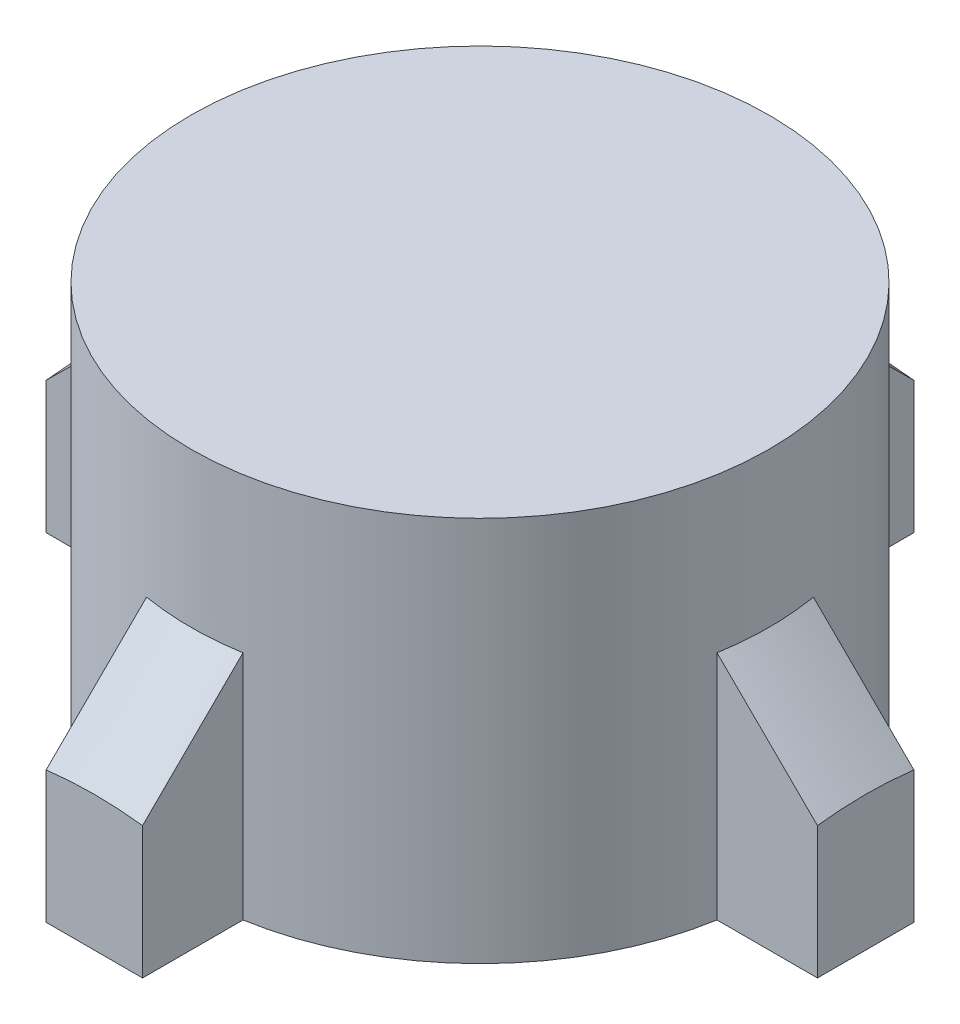
from build123d import *

# Parameters (mm, degrees)
SKETCH1_R           = 75
BOSS_EXTRUDE1_DEPTH = 100
BOSS_EXTRUDE2_DEPTH = 10
CHAMFER1_SIZE       = 50


with BuildPart() as part:
    # Sketch1 → Boss-Extrude1 (new body)
    with BuildSketch(Plane(origin=(0, 0, 0), x_dir=(1, 0, 0), z_dir=(0, 1, 0))):
        with Locations(Location((0, 0, 0), (0, 0, 270))):
            Circle(SKETCH1_R)
    extrude(amount=BOSS_EXTRUDE1_DEPTH)

    # Sketch2 → Boss-Extrude2 (add)
    with BuildSketch(Plane.XZ):
        with BuildLine():
            Line((-100, 12.5), (-100, -12.5))
            Line((-100, -12.5), (-73.950997289, -12.5))
            ThreePointArc((-73.950997289, -12.5), (-75, 0), (-73.950997289, 12.5))
            Line((-73.950997289, 12.5), (-100, 12.5))
        make_face()
        with BuildLine():
            ThreePointArc((75, 0), (74.737289209, -6.271969521), (73.950997289, -12.5))
            Line((73.950997289, -12.5), (100, -12.5))
            Line((100, -12.5), (100, 12.5))
            Line((100, 12.5), (73.950997289, 12.5))
            ThreePointArc((73.950997289, 12.5), (74.737289209, 6.271969521), (75, 0))
        make_face()
        with BuildLine():
            Line((-12.5, 100), (-12.5, 73.950997289))
            ThreePointArc((-12.5, 73.950997289), (0, 75), (12.5, 73.950997289))
            Line((12.5, 73.950997289), (12.5, 100))
            Line((12.5, 100), (-12.5, 100))
        make_face()
        with BuildLine():
            ThreePointArc((12.5, -73.950997289), (0, -75), (-12.5, -73.950997289))
            Line((-12.5, -73.950997289), (-12.5, -100))
            Line((-12.5, -100), (12.5, -100))
            Line((12.5, -100), (12.5, -73.950997289))
        make_face()
    extrude(amount=-BOSS_EXTRUDE2_DEPTH)

    # Chamfer1
    # the kernel refuses this chamfer: 50 mm, written as the material it adds along each edge
    with BuildSketch(Plane(origin=(0, 10, 0), x_dir=(0.9519856818942184, 0, 0.30614255089484044), z_dir=(-0.30614255089484044, 0, 0.9519856818942184))) as chamfer1_piece_1_section:
        Polygon((75, CHAMFER1_SIZE), (75 + CHAMFER1_SIZE, 0), (75, 0), align=None)
    chamfer1_piece_1 = revolve(axis=Axis((0, 10, 0), (0, 1, 0)), revolution_arc=215.653831418, mode=Mode.PRIVATE)
    chamfer1_piece_1 = split(chamfer1_piece_1, bisect_by=Plane(origin=(-12.5, 29.622120316, 1e-09), z_dir=(1, 0, 0)), keep=Keep.TOP, mode=Mode.PRIVATE)
    chamfer1_piece_1 = split(chamfer1_piece_1, bisect_by=Plane(origin=(85.193298793, 29.622120316, 12.5), z_dir=(0, 0, -1)), keep=Keep.TOP, mode=Mode.PRIVATE)
    chamfer1_piece_1 = split(chamfer1_piece_1, bisect_by=Plane(origin=(85.193298793, 29.622120316, -12.5), z_dir=(0, 0, 1)), keep=Keep.TOP, mode=Mode.PRIVATE)
    chamfer1_piece_1 = split(chamfer1_piece_1, bisect_by=Plane(origin=(100, 29.622120316, 1e-09), z_dir=(-1, 0, 0)), keep=Keep.TOP, mode=Mode.PRIVATE)
    add(chamfer1_piece_1)
    with BuildSketch(Plane(origin=(0, 10, 0), x_dir=(0.9519856818942184, 0, 0.30614255089484044), z_dir=(-0.30614255089484044, 0, 0.9519856818942184))) as chamfer1_piece_2_section:
        Polygon((75, CHAMFER1_SIZE), (75 + CHAMFER1_SIZE, 0), (75, 0), align=None)
    chamfer1_piece_2 = revolve(axis=Axis((0, 10, 0), (0, 1, 0)), revolution_arc=215.653831418, mode=Mode.PRIVATE)
    chamfer1_piece_2 = split(chamfer1_piece_2, bisect_by=Plane(origin=(12.5, 29.62212033, -85.19329881), z_dir=(-1, 0, 0)), keep=Keep.TOP, mode=Mode.PRIVATE)
    chamfer1_piece_2 = split(chamfer1_piece_2, bisect_by=Plane(origin=(-12.5, 29.62212033, -85.19329881), z_dir=(1, 0, 0)), keep=Keep.TOP, mode=Mode.PRIVATE)
    chamfer1_piece_2 = split(chamfer1_piece_2, bisect_by=Plane(origin=(0, 29.62212033, -100), z_dir=(0, 0, 1)), keep=Keep.TOP, mode=Mode.PRIVATE)
    add(chamfer1_piece_2)
    with BuildSketch(Plane(origin=(0, 10, 0), x_dir=(0.9519856818942184, 0, 0.30614255089484044), z_dir=(-0.30614255089484044, 0, 0.9519856818942184))) as chamfer1_piece_3_section:
        Polygon((75, CHAMFER1_SIZE), (75 + CHAMFER1_SIZE, 0), (75, 0), align=None)
    chamfer1_piece_3 = revolve(axis=Axis((0, 10, 0), (0, 1, 0)), revolution_arc=215.653831418, mode=Mode.PRIVATE)
    chamfer1_piece_3 = split(chamfer1_piece_3, bisect_by=Plane(origin=(-12.5, 29.622120318, 1e-09), z_dir=(-1, 0, 0)), keep=Keep.TOP, mode=Mode.PRIVATE)
    chamfer1_piece_3 = split(chamfer1_piece_3, bisect_by=Plane(origin=(-85.193298793, 29.622120318, 12.5), z_dir=(0, 0, -1)), keep=Keep.TOP, mode=Mode.PRIVATE)
    chamfer1_piece_3 = split(chamfer1_piece_3, bisect_by=Plane(origin=(-85.193298793, 29.622120318, -12.5), z_dir=(0, 0, 1)), keep=Keep.TOP, mode=Mode.PRIVATE)
    chamfer1_piece_3 = split(chamfer1_piece_3, bisect_by=Plane(origin=(-100, 29.622120318, 1e-09), z_dir=(1, 0, 0)), keep=Keep.TOP, mode=Mode.PRIVATE)
    add(chamfer1_piece_3)
    with BuildSketch(Plane(origin=(0, 10, 0), x_dir=(-0.30614255089485254, 0, 0.9519856818942145), z_dir=(-0.9519856818942145, 0, -0.30614255089485254))) as chamfer1_piece_4_section:
        Polygon((75, CHAMFER1_SIZE), (75 + CHAMFER1_SIZE, 0), (75, 0), align=None)
    chamfer1_piece_4 = revolve(axis=Axis((0, 10, 0), (0, 1, 0)), revolution_arc=215.653831418, mode=Mode.PRIVATE)
    chamfer1_piece_4 = split(chamfer1_piece_4, bisect_by=Plane(origin=(-1e-09, 29.622120316, -12.5), z_dir=(0, 0, 1)), keep=Keep.TOP, mode=Mode.PRIVATE)
    chamfer1_piece_4 = split(chamfer1_piece_4, bisect_by=Plane(origin=(12.5, 29.622120316, 85.193298793), z_dir=(-1, 0, 0)), keep=Keep.TOP, mode=Mode.PRIVATE)
    chamfer1_piece_4 = split(chamfer1_piece_4, bisect_by=Plane(origin=(-1e-09, 29.622120316, 100), z_dir=(0, 0, -1)), keep=Keep.TOP, mode=Mode.PRIVATE)
    chamfer1_piece_4 = split(chamfer1_piece_4, bisect_by=Plane(origin=(-12.5, 29.622120316, 85.193298793), z_dir=(1, 0, 0)), keep=Keep.TOP, mode=Mode.PRIVATE)
    add(chamfer1_piece_4)
    with BuildSketch(Plane(origin=(0, 10, 0), x_dir=(-0.30614255089485254, 0, 0.9519856818942145), z_dir=(-0.9519856818942145, 0, -0.30614255089485254))) as chamfer1_piece_5_section:
        Polygon((75, CHAMFER1_SIZE), (75 + CHAMFER1_SIZE, 0), (75, 0), align=None)
    chamfer1_piece_5 = revolve(axis=Axis((0, 10, 0), (0, 1, 0)), revolution_arc=215.653831418, mode=Mode.PRIVATE)
    chamfer1_piece_5 = split(chamfer1_piece_5, bisect_by=Plane(origin=(85.19329881, 29.62212033, 12.5), z_dir=(0, 0, -1)), keep=Keep.TOP, mode=Mode.PRIVATE)
    chamfer1_piece_5 = split(chamfer1_piece_5, bisect_by=Plane(origin=(85.19329881, 29.62212033, -12.5), z_dir=(0, 0, 1)), keep=Keep.TOP, mode=Mode.PRIVATE)
    chamfer1_piece_5 = split(chamfer1_piece_5, bisect_by=Plane(origin=(100, 29.62212033, 0), z_dir=(-1, 0, 0)), keep=Keep.TOP, mode=Mode.PRIVATE)
    add(chamfer1_piece_5)
    with BuildSketch(Plane(origin=(0, 10, 0), x_dir=(-0.30614255089485254, 0, 0.9519856818942145), z_dir=(-0.9519856818942145, 0, -0.30614255089485254))) as chamfer1_piece_6_section:
        Polygon((75, CHAMFER1_SIZE), (75 + CHAMFER1_SIZE, 0), (75, 0), align=None)
    chamfer1_piece_6 = revolve(axis=Axis((0, 10, 0), (0, 1, 0)), revolution_arc=215.653831418, mode=Mode.PRIVATE)
    chamfer1_piece_6 = split(chamfer1_piece_6, bisect_by=Plane(origin=(-1e-09, 29.622120318, -12.5), z_dir=(0, 0, -1)), keep=Keep.TOP, mode=Mode.PRIVATE)
    chamfer1_piece_6 = split(chamfer1_piece_6, bisect_by=Plane(origin=(12.5, 29.622120318, -85.193298793), z_dir=(-1, 0, 0)), keep=Keep.TOP, mode=Mode.PRIVATE)
    chamfer1_piece_6 = split(chamfer1_piece_6, bisect_by=Plane(origin=(-12.5, 29.622120318, -85.193298793), z_dir=(1, 0, 0)), keep=Keep.TOP, mode=Mode.PRIVATE)
    chamfer1_piece_6 = split(chamfer1_piece_6, bisect_by=Plane(origin=(-1e-09, 29.622120318, -100), z_dir=(0, 0, 1)), keep=Keep.TOP, mode=Mode.PRIVATE)
    add(chamfer1_piece_6)
    with BuildSketch(Plane(origin=(0, 10, 0), x_dir=(-0.9519928676316486, 0, -0.3061202051130742), z_dir=(0.3061202051130742, 0, -0.9519928676316486))) as chamfer1_piece_7_section:
        Polygon((75, CHAMFER1_SIZE), (75 + CHAMFER1_SIZE, 0), (75, 0), align=None)
    chamfer1_piece_7 = revolve(axis=Axis((0, 10, 0), (0, 1, 0)), revolution_arc=107.825570821, mode=Mode.PRIVATE)
    chamfer1_piece_7 = split(chamfer1_piece_7, bisect_by=Plane(origin=(-85.193298794, 29.622120316, -12.5), z_dir=(0, 0, 1)), keep=Keep.TOP, mode=Mode.PRIVATE)
    chamfer1_piece_7 = split(chamfer1_piece_7, bisect_by=Plane(origin=(-85.193298794, 29.622120316, 12.5), z_dir=(0, 0, -1)), keep=Keep.TOP, mode=Mode.PRIVATE)
    chamfer1_piece_7 = split(chamfer1_piece_7, bisect_by=Plane(origin=(-100, 29.622120316, -1e-09), z_dir=(1, 0, 0)), keep=Keep.TOP, mode=Mode.PRIVATE)
    add(chamfer1_piece_7)
    with BuildSketch(Plane(origin=(0, 10, 0), x_dir=(-0.9519928676316486, 0, -0.3061202051130742), z_dir=(0.3061202051130742, 0, -0.9519928676316486))) as chamfer1_piece_8_section:
        Polygon((75, CHAMFER1_SIZE), (75 + CHAMFER1_SIZE, 0), (75, 0), align=None)
    chamfer1_piece_8 = revolve(axis=Axis((0, 10, 0), (0, 1, 0)), revolution_arc=107.825570821, mode=Mode.PRIVATE)
    chamfer1_piece_8 = split(chamfer1_piece_8, bisect_by=Plane(origin=(-12.5, 29.622120326, 85.193298813), z_dir=(1, 0, 0)), keep=Keep.TOP, mode=Mode.PRIVATE)
    chamfer1_piece_8 = split(chamfer1_piece_8, bisect_by=Plane(origin=(-6.281740257, 29.622120326, 100), z_dir=(0, 0, -1)), keep=Keep.TOP, mode=Mode.PRIVATE)
    add(chamfer1_piece_8)
    with BuildSketch(Plane(origin=(0, 10, 0), x_dir=(0.30614255089486275, 0, -0.9519856818942113), z_dir=(0.9519856818942113, 0, 0.30614255089486275))) as chamfer1_piece_9_section:
        Polygon((75, CHAMFER1_SIZE), (75 + CHAMFER1_SIZE, 0), (75, 0), align=None)
    chamfer1_piece_9 = revolve(axis=Axis((0, 10, 0), (0, 1, 0)), revolution_arc=215.653831418, mode=Mode.PRIVATE)
    chamfer1_piece_9 = split(chamfer1_piece_9, bisect_by=Plane(origin=(1e-09, 29.622120316, 12.5), z_dir=(0, 0, -1)), keep=Keep.TOP, mode=Mode.PRIVATE)
    chamfer1_piece_9 = split(chamfer1_piece_9, bisect_by=Plane(origin=(12.5, 29.622120316, -85.193298793), z_dir=(-1, 0, 0)), keep=Keep.TOP, mode=Mode.PRIVATE)
    chamfer1_piece_9 = split(chamfer1_piece_9, bisect_by=Plane(origin=(-12.5, 29.622120316, -85.193298793), z_dir=(1, 0, 0)), keep=Keep.TOP, mode=Mode.PRIVATE)
    chamfer1_piece_9 = split(chamfer1_piece_9, bisect_by=Plane(origin=(1e-09, 29.622120316, -100), z_dir=(0, 0, 1)), keep=Keep.TOP, mode=Mode.PRIVATE)
    add(chamfer1_piece_9)
    with BuildSketch(Plane(origin=(0, 10, 0), x_dir=(0.30614255089486275, 0, -0.9519856818942113), z_dir=(0.9519856818942113, 0, 0.30614255089486275))) as chamfer1_piece_10_section:
        Polygon((75, CHAMFER1_SIZE), (75 + CHAMFER1_SIZE, 0), (75, 0), align=None)
    chamfer1_piece_10 = revolve(axis=Axis((0, 10, 0), (0, 1, 0)), revolution_arc=215.653831418, mode=Mode.PRIVATE)
    chamfer1_piece_10 = split(chamfer1_piece_10, bisect_by=Plane(origin=(-85.19329881, 29.62212033, -12.5), z_dir=(0, 0, 1)), keep=Keep.TOP, mode=Mode.PRIVATE)
    chamfer1_piece_10 = split(chamfer1_piece_10, bisect_by=Plane(origin=(-85.19329881, 29.62212033, 12.5), z_dir=(0, 0, -1)), keep=Keep.TOP, mode=Mode.PRIVATE)
    chamfer1_piece_10 = split(chamfer1_piece_10, bisect_by=Plane(origin=(-100, 29.62212033, 0), z_dir=(1, 0, 0)), keep=Keep.TOP, mode=Mode.PRIVATE)
    add(chamfer1_piece_10)
    with BuildSketch(Plane(origin=(0, 10, 0), x_dir=(0.30614255089486275, 0, -0.9519856818942113), z_dir=(0.9519856818942113, 0, 0.30614255089486275))) as chamfer1_piece_11_section:
        Polygon((75, CHAMFER1_SIZE), (75 + CHAMFER1_SIZE, 0), (75, 0), align=None)
    chamfer1_piece_11 = revolve(axis=Axis((0, 10, 0), (0, 1, 0)), revolution_arc=215.653831418, mode=Mode.PRIVATE)
    chamfer1_piece_11 = split(chamfer1_piece_11, bisect_by=Plane(origin=(1e-09, 29.622120318, 12.5), z_dir=(0, 0, 1)), keep=Keep.TOP, mode=Mode.PRIVATE)
    chamfer1_piece_11 = split(chamfer1_piece_11, bisect_by=Plane(origin=(12.5, 29.622120318, 85.193298793), z_dir=(-1, 0, 0)), keep=Keep.TOP, mode=Mode.PRIVATE)
    chamfer1_piece_11 = split(chamfer1_piece_11, bisect_by=Plane(origin=(1e-09, 29.622120318, 100), z_dir=(0, 0, -1)), keep=Keep.TOP, mode=Mode.PRIVATE)
    chamfer1_piece_11 = split(chamfer1_piece_11, bisect_by=Plane(origin=(-12.5, 29.622120318, 85.193298793), z_dir=(1, 0, 0)), keep=Keep.TOP, mode=Mode.PRIVATE)
    add(chamfer1_piece_11)
    with BuildSketch(Plane(origin=(0, 10, 0), x_dir=(0, 0, 1), z_dir=(-1, 0, 0))) as chamfer1_piece_12_section:
        Polygon((75, CHAMFER1_SIZE), (75 + CHAMFER1_SIZE, 0), (75, 0), align=None)
    chamfer1_piece_12 = revolve(axis=Axis((0, 10, 0), (0, 1, 0)), revolution_arc=107.825570821, mode=Mode.PRIVATE)
    chamfer1_piece_12 = split(chamfer1_piece_12, bisect_by=Plane(origin=(12.5, 29.622120324, 85.193298814), z_dir=(-1, 0, 0)), keep=Keep.TOP, mode=Mode.PRIVATE)
    chamfer1_piece_12 = split(chamfer1_piece_12, bisect_by=Plane(origin=(6.281740257, 29.622120324, 100), z_dir=(0, 0, -1)), keep=Keep.TOP, mode=Mode.PRIVATE)
    add(chamfer1_piece_12)
    with BuildSketch(Plane(origin=(0, 10, 0), x_dir=(0, 0, 1), z_dir=(-1, 0, 0))) as chamfer1_piece_13_section:
        Polygon((75, CHAMFER1_SIZE), (75 + CHAMFER1_SIZE, 0), (75, 0), align=None)
    chamfer1_piece_13 = revolve(axis=Axis((0, 10, 0), (0, 1, 0)), revolution_arc=107.825570821, mode=Mode.PRIVATE)
    chamfer1_piece_13 = split(chamfer1_piece_13, bisect_by=Plane(origin=(85.193298792, 29.622120318, 12.5), z_dir=(0, 0, -1)), keep=Keep.TOP, mode=Mode.PRIVATE)
    chamfer1_piece_13 = split(chamfer1_piece_13, bisect_by=Plane(origin=(85.193298792, 29.622120318, -12.5), z_dir=(0, 0, 1)), keep=Keep.TOP, mode=Mode.PRIVATE)
    chamfer1_piece_13 = split(chamfer1_piece_13, bisect_by=Plane(origin=(100, 29.622120318, -1e-09), z_dir=(-1, 0, 0)), keep=Keep.TOP, mode=Mode.PRIVATE)
    add(chamfer1_piece_13)


solid = part.part
